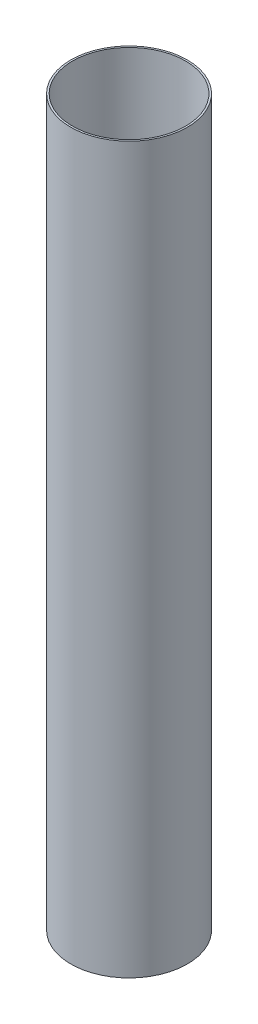
from build123d import *

# Parameters (mm, degrees)
SKETCH1_R           = 51.1048
SKETCH1_R_2         = 49.53
BOSS_EXTRUDE1_DEPTH = 635


with BuildPart() as part:
    # Sketch1 → Boss-Extrude1 (new body)
    with BuildSketch(Plane(origin=(0, 0, 0), x_dir=(1, 0, 0), z_dir=(0, 1, 0))):
        Circle(SKETCH1_R)
        Circle(SKETCH1_R_2, mode=Mode.SUBTRACT)
    extrude(amount=BOSS_EXTRUDE1_DEPTH)


solid = part.part
